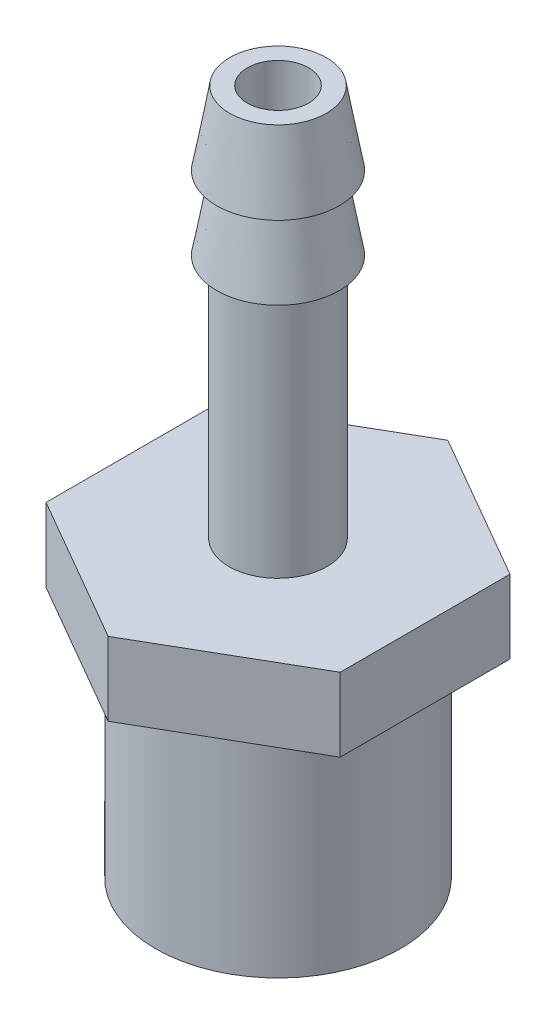
from build123d import *

# Parameters (mm, degrees)
EXTRUSION1_DEPTH  = 3
ESQUISSE3_R       = 5
ESQUISSE3_R_2     = 3.5
EXTRUSION2_DEPTH  = 9
ESQUISSE4_R       = 2
EXTRUSION3_DEPTH  = 10
ESQUISSE5_R       = 2.5
EXTRUSION4_DEPTH  = 3
CHANFREIN1_SIZE   = 3
CHANFREIN1_SIZE_2 = 0.528980942
ESQUISSE6_R       = 2.5
EXTRUSION5_DEPTH  = 3
CHANFREIN2_SIZE   = 3
CHANFREIN2_SIZE_2 = 0.528980942
EXTRUSION6_REACH  = 31.462
ESQUISSE7_R       = 1.25


with BuildPart() as part:
    # Esquisse2 → Extrusion1 (new body)
    with BuildSketch(Plane(origin=(0, 0, 0), x_dir=(1, 0, 0), z_dir=(0, 1, 0))):
        Polygon((0, 6.92820323), (-6, 3.464101615), (-6, -3.464101615), (0, -6.92820323), (6, -3.464101615), (6, 3.464101615), align=None)
    extrude(amount=EXTRUSION1_DEPTH)

    # Esquisse3 → Extrusion2 (add)
    with BuildSketch(Plane.XZ):
        with Locations(Location((0, 0, 0), (0, 0, 90))):
            Circle(ESQUISSE3_R)
        with Locations(Location((0, 0, 0), (0, 0, 270))):
            Circle(ESQUISSE3_R_2, mode=Mode.SUBTRACT)
    extrude(amount=EXTRUSION2_DEPTH)

    # Esquisse4 → Extrusion3 (add)
    with BuildSketch(Plane(origin=(0, 3, 0), x_dir=(-1, 0, 0), z_dir=(0, 1, 0))):
        with Locations(Location((0, 0, 0), (0, 0, 90))):
            Circle(ESQUISSE4_R)
    extrude(amount=EXTRUSION3_DEPTH)

    # Esquisse5 → Extrusion4 (add)
    with BuildSketch(Plane(origin=(0, 13, 0), x_dir=(1, 0, 0), z_dir=(0, 1, 0))):
        with Locations(Location((0, 0, 0), (0, 0, 270))):
            Circle(ESQUISSE5_R)
    extrude(amount=EXTRUSION4_DEPTH)

    # Chanfrein1
    # the kernel refuses this chamfer: 3, 0.528980942 mm, written as the material it takes off along each edge
    with BuildSketch(Plane(origin=(0, 16, 0), x_dir=(0, 0, 1), z_dir=(-1, 0, 0))) as chanfrein1_piece_1:
        Polygon((2.5, -CHANFREIN1_SIZE), (2.5 - CHANFREIN1_SIZE_2, 0), (2.5, 0), align=None)
    revolve(axis=Axis((0, 16, 0), (0, 1, 0)), mode=Mode.SUBTRACT)

    # Esquisse6 → Extrusion5 (add)
    with BuildSketch(Plane(origin=(0, 16, 0), x_dir=(1, 0, 0), z_dir=(0, 1, 0))):
        with Locations(Location((0, 0, 0), (0, 0, 270))):
            Circle(ESQUISSE6_R)
    extrude(amount=EXTRUSION5_DEPTH)

    # Chanfrein2
    # the kernel refuses this chamfer: 3, 0.528980942 mm, written as the material it takes off along each edge
    with BuildSketch(Plane(origin=(0, 19, 0), x_dir=(0, 0, 1), z_dir=(-1, 0, 0))) as chanfrein2_piece_1:
        Polygon((2.5, -CHANFREIN2_SIZE), (2.5 - CHANFREIN2_SIZE_2, 0), (2.5, 0), align=None)
    revolve(axis=Axis((0, 19, 0), (0, 1, 0)), mode=Mode.SUBTRACT)

    # Esquisse7 → Extrusion6 (cut, up to next)
    with BuildSketch(Plane(origin=(0, 19, 0), x_dir=(1, 0, 0), z_dir=(0, 1, 0)), mode=Mode.PRIVATE) as extrusion6_sk1:
        with Locations(Location((0, 0, 0), (0, 0, 270))):
            Circle(ESQUISSE7_R)
    extrusion6_tool1 = extrude(extrusion6_sk1.sketch, amount=-EXTRUSION6_REACH, mode=Mode.PRIVATE) & part.part
    add(extrusion6_tool1.solids().sort_by_distance((0, 19, 0))[0], mode=Mode.SUBTRACT)


solid = part.part
